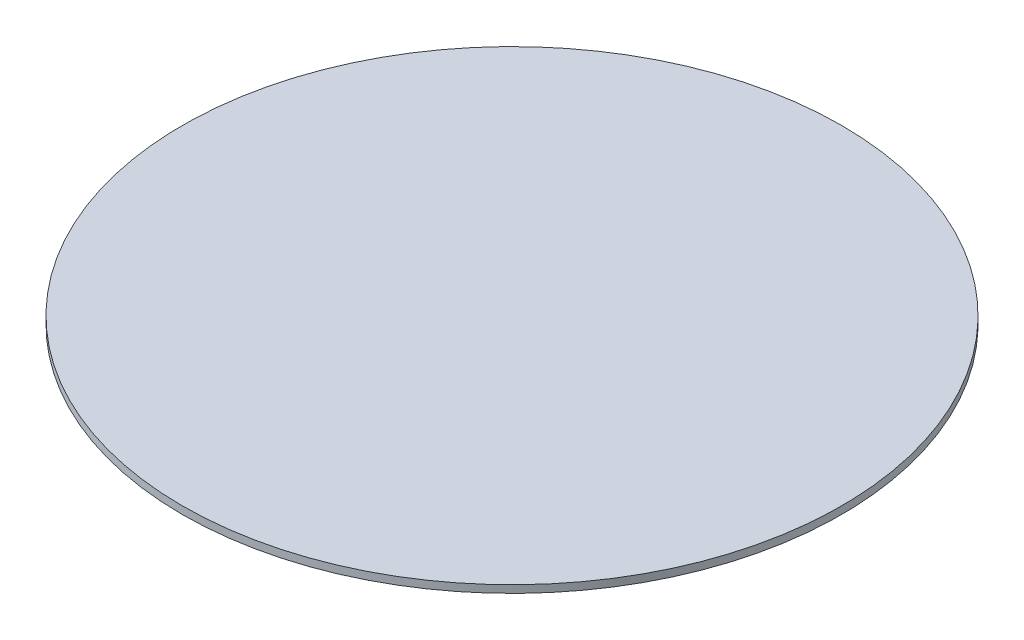
from build123d import *

# Parameters (mm, degrees)
SKETCH1_R           = 175
BOSS_EXTRUDE1_DEPTH = 4


with BuildPart() as part:
    # Sketch1 → Boss-Extrude1 (new body)
    with BuildSketch(Plane(origin=(0, 0, 0), x_dir=(1, 0, 0), z_dir=(0, 1, 0))):
        Circle(SKETCH1_R)
    extrude(amount=BOSS_EXTRUDE1_DEPTH)


solid = part.part
